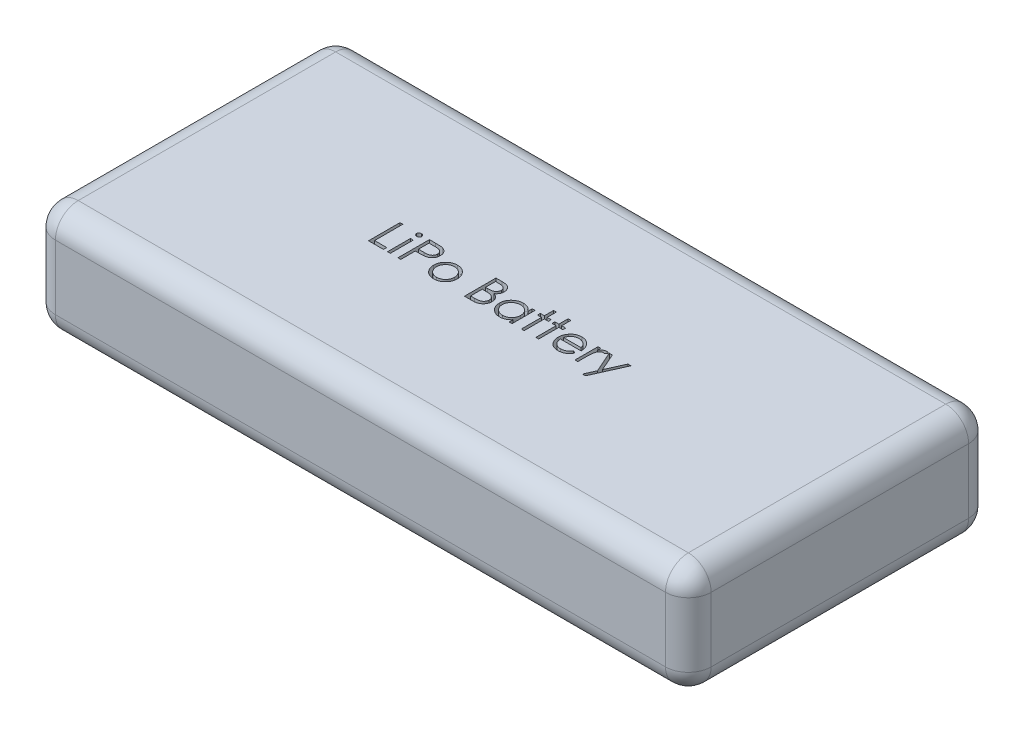
from build123d import *

# Parameters (mm, degrees)
SKETCH1_W           = 72.9742
SKETCH1_H           = 33.7312
BOSS_EXTRUDE1_DEPTH = 12.2682
SKETCH2_W           = 0.314102564
SKETCH2_H           = 2.557692308
CUT_EXTRUDE1_DEPTH  = 1.778
FILLET1_R           = 2.54


with BuildPart() as part:
    # Sketch1 → Boss-Extrude1 (new body)
    with BuildSketch(Plane(origin=(0, 0, 0), x_dir=(1, 0, 0), z_dir=(0, 1, 0))):
        with Locations((36.4871, 16.8656)):
            Rectangle(SKETCH1_W, SKETCH1_H)
    extrude(amount=BOSS_EXTRUDE1_DEPTH)

    # Sketch2 → Cut-Extrude1 (cut)
    # profile 1 of 12: a face of its own
    with BuildSketch(Plane(origin=(0, 12.2682, 0), x_dir=(1, 0, 0), z_dir=(0, 1, 0))):
        Polygon((22.570507121, 18.316928385), (22.884609685, 18.316928385), (22.884609685, 15.175902744), (24.230763531, 15.175902744), (24.230763531, 14.816928385), (22.570507121, 14.816928385), align=None)
    # profile 2 of 12: a face of its own
    with BuildSketch(Plane(origin=(0, 12.2682, 0), x_dir=(1, 0, 0), z_dir=(0, 1, 0))):
        with BuildLine():
            add(Edge.make_bspline(
                [(24.835130518, 18.45154377), (24.854621834, 18.450639617), (24.892789574, 18.448869113), (24.947982841, 18.433707636), (24.998239853, 18.408007951), (25.042817586, 18.37352827), (25.081069473, 18.332978826), (25.107850183, 18.285717858), (25.125062579, 18.234659219), (25.127141135, 18.19904413), (25.128199428, 18.180910757)],
                knots=[0, 0, 0, 0, 1.055194115, 2.066272739, 3.074728998, 4.095836921, 5.109056067, 6.073838105, 7.019297344, 8, 8, 8, 8], degree=3))
            add(Edge.make_bspline(
                [(25.128199428, 18.180910757), (25.127117268, 18.163248104), (25.124977967, 18.128331129), (25.107863478, 18.078157657), (25.08084124, 18.031553373), (25.042842115, 17.991082663), (24.998233354, 17.956622043), (24.947984568, 17.930917304), (24.892789119, 17.915757167), (24.85462168, 17.913986478), (24.835130518, 17.913082231)],
                knots=[0, 0, 0, 0, 0.96129708, 1.900370562, 2.859976407, 3.87933698, 4.906634145, 5.921202961, 6.938410037, 8, 8, 8, 8], degree=3))
            add(Edge.make_bspline(
                [(24.835130518, 17.913082231), (24.815862243, 17.913951951), (24.778359063, 17.915644748), (24.72399222, 17.931214766), (24.674163731, 17.956630839), (24.629499058, 17.990857024), (24.592268865, 18.031801921), (24.56517054, 18.078129215), (24.548095578, 18.12833837), (24.545950949, 18.163250536), (24.544866095, 18.180910757)],
                knots=[0, 0, 0, 0, 1.054934014, 2.053291228, 3.073705704, 4.106921865, 5.123545215, 6.088680038, 7.033164197, 8, 8, 8, 8], degree=3))
            add(Edge.make_bspline(
                [(24.544866095, 18.180910757), (24.545927182, 18.199041606), (24.548011223, 18.234651739), (24.565183339, 18.285746772), (24.592043147, 18.332728274), (24.62952371, 18.373753773), (24.67415717, 18.407999208), (24.723993915, 18.433410189), (24.778358615, 18.448981529), (24.815862091, 18.450674143), (24.835130518, 18.45154377)],
                knots=[0, 0, 0, 0, 0.98631895, 1.937192651, 2.907499808, 3.917963147, 4.944918757, 5.95915025, 6.951458133, 8, 8, 8, 8], degree=3))
        make_face()
    # profile 3 of 12: a face of its own
    with BuildSketch(Plane(origin=(0, 12.2682, 0), x_dir=(1, 0, 0), z_dir=(0, 1, 0))):
        with Locations((24.836532762, 16.095774539)):
            Rectangle(SKETCH2_W, SKETCH2_H)
    # profile 4 of 12: a face of its own
    with BuildSketch(Plane(origin=(0, 12.2682, 0), x_dir=(1, 0, 0), z_dir=(0, 1, 0))):
        with BuildLine():
            Line((25.846148146, 18.316928385), (26.532546383, 18.316928385))
            add(Edge.make_bspline(
                [(26.532546383, 18.316928385), (26.57975729, 18.316876489), (26.670215482, 18.316777053), (26.799930538, 18.313762307), (26.91774027, 18.309735615), (27.023390651, 18.304153722), (27.117206749, 18.297557132), (27.198764048, 18.288305093), (27.268703605, 18.278644797), (27.310610054, 18.26882339), (27.329721864, 18.26434425)],
                knots=[0, 0, 0, 0, 1.415646017, 2.712440637, 3.8905458, 4.950247383, 5.884950622, 6.709939814, 7.411656543, 8, 8, 8, 8], degree=3))
            add(Edge.make_bspline(
                [(27.329721864, 18.26434425), (27.353915398, 18.257722301), (27.401732375, 18.244634439), (27.470633418, 18.218420715), (27.536187264, 18.18733855), (27.598618822, 18.15191461), (27.657160905, 18.110629046), (27.712686946, 18.065155428), (27.764706927, 18.01444386), (27.812928318, 17.95906312), (27.857213116, 17.89994291), (27.895342799, 17.83620068), (27.927270026, 17.768909377), (27.954653297, 17.698115806), (27.974361752, 17.623225482), (27.989208651, 17.54475877), (27.998632279, 17.46272408), (27.999534841, 17.406664212), (27.9999943, 17.378126302)],
                knots=[0, 0, 0, 0, 0.999701418, 1.975846123, 2.934577507, 3.890451536, 4.834027766, 5.787354733, 6.749476667, 7.726910423, 8.712836071, 9.690891519, 10.682875813, 11.679750201, 12.712814741, 13.765529915, 14.8625177, 16, 16, 16, 16], degree=3))
            add(Edge.make_bspline(
                [(27.9999943, 17.378126302), (27.999572875, 17.349348525), (27.998748329, 17.293042861), (27.988852044, 17.210670073), (27.975521852, 17.131951683), (27.9550248, 17.057062232), (27.928179127, 16.986446462), (27.896687074, 16.91902523), (27.858703544, 16.855945558), (27.815058714, 16.79697844), (27.76650712, 16.742068528), (27.713254182, 16.691613733), (27.655514889, 16.645909395), (27.593472741, 16.604853051), (27.526522892, 16.569396772), (27.455680739, 16.537639467), (27.380330522, 16.510968406), (27.328188008, 16.496938345), (27.301676992, 16.489804988)],
                knots=[0, 0, 0, 0, 1.121902311, 2.195077645, 3.232258892, 4.234102512, 5.217864754, 6.176164875, 7.132989551, 8.084763148, 9.034132444, 9.988522005, 10.94243251, 11.903244335, 12.886203696, 13.894208494, 14.929344452, 16, 16, 16, 16], degree=3))
            add(Edge.make_bspline(
                [(27.301676992, 16.489804988), (27.279749658, 16.485142006), (27.231694631, 16.474922812), (27.152551909, 16.463514355), (27.060406523, 16.453776755), (26.955384243, 16.446475617), (26.837579338, 16.440225249), (26.706928081, 16.435257155), (26.563174004, 16.432527301), (26.462902759, 16.432386508), (26.410551191, 16.432313)],
                knots=[0, 0, 0, 0, 0.601384939, 1.31797006, 2.144135048, 3.087295005, 4.142315834, 5.309527816, 6.595305764, 8, 8, 8, 8], degree=3))
            Line((26.410551191, 16.432313), (26.16025071, 16.432313))
            Line((26.16025071, 16.432313), (26.16025071, 14.816928385))
            Line((26.16025071, 14.816928385), (25.846148146, 14.816928385))
            Line((25.846148146, 14.816928385), (25.846148146, 18.316928385))
        make_face()
        with BuildLine():
            Line((26.16025071, 17.957954026), (26.16025071, 16.791287359))
            Line((26.16025071, 16.791287359), (26.773031159, 16.78357502))
            add(Edge.make_bspline(
                [(26.773031159, 16.78357502), (26.802951085, 16.783559556), (26.860710885, 16.783529704), (26.944147108, 16.787514927), (27.021556395, 16.79211546), (27.092700971, 16.798851383), (27.157612905, 16.808372641), (27.216400434, 16.817984379), (27.268607717, 16.831889741), (27.329706919, 16.850612811), (27.397790266, 16.882545426), (27.471857815, 16.928895316), (27.534628401, 16.987976025), (27.588946698, 17.054403856), (27.632052576, 17.128302985), (27.663608568, 17.207371922), (27.682149725, 17.290799772), (27.684635919, 17.34788791), (27.685891736, 17.376724058)],
                knots=[0, 0, 0, 0, 1.160613943, 2.240541288, 3.23993089, 4.169200891, 5.011653406, 5.7853311, 6.478053781, 7.106038997, 8.262395093, 9.384106736, 10.481365981, 11.59014053, 12.70357646, 13.786202915, 14.881775077, 16, 16, 16, 16], degree=3))
            add(Edge.make_bspline(
                [(27.685891736, 17.376724058), (27.684629089, 17.404862572), (27.682119105, 17.460798454), (27.663463241, 17.542777214), (27.632113927, 17.621012919), (27.588657333, 17.693986004), (27.535916203, 17.760174808), (27.47461686, 17.817671935), (27.404903599, 17.863893638), (27.340055368, 17.893726919), (27.282454181, 17.911942195), (27.232422222, 17.924687035), (27.175931547, 17.934862642), (27.112963768, 17.943102144), (27.044006934, 17.950155606), (26.968468619, 17.954941583), (26.886634976, 17.957743039), (26.829824405, 17.957881994), (26.800374909, 17.957954026)],
                knots=[0, 0, 0, 0, 1.120700087, 2.227813068, 3.331159281, 4.466773991, 5.599788987, 6.693661531, 7.80175334, 8.91857717, 9.525282508, 10.207424825, 10.974604443, 11.810962634, 12.737642355, 13.736264703, 14.826523623, 16, 16, 16, 16], degree=3))
            Line((26.800374909, 17.957954026), (26.16025071, 17.957954026))
        make_face(mode=Mode.SUBTRACT)
    # profile 5 of 12: a face of its own
    with BuildSketch(Plane(origin=(0, 12.2682, 0), x_dir=(1, 0, 0), z_dir=(0, 1, 0))):
        with BuildLine():
            add(Edge.make_bspline(
                [(29.863576031, 17.419492488), (29.911567304, 17.418470596), (30.005666461, 17.416466918), (30.143474347, 17.395051952), (30.275019483, 17.362304588), (30.400805675, 17.317033026), (30.519221971, 17.256351075), (30.631993215, 17.183941784), (30.738810224, 17.09815919), (30.802833253, 17.031801122), (30.835330839, 16.998118289)],
                knots=[0, 0, 0, 0, 1.054011418, 2.066658804, 3.057071809, 4.030435133, 4.997543892, 5.974964718, 6.972108034, 8, 8, 8, 8], degree=3))
            add(Edge.make_bspline(
                [(30.835330839, 16.998118289), (30.863312793, 16.965904303), (30.918735173, 16.902099761), (30.989800892, 16.798644148), (31.051022452, 16.691504047), (31.100085413, 16.579256721), (31.138770436, 16.462882049), (31.166236133, 16.341980038), (31.182573068, 16.216817691), (31.184776035, 16.131813853), (31.185891736, 16.088763321)],
                knots=[0, 0, 0, 0, 1.025258237, 2.030674902, 3.01204498, 3.988269485, 4.97094183, 5.956517959, 6.965070386, 8, 8, 8, 8], degree=3))
            add(Edge.make_bspline(
                [(31.185891736, 16.088763321), (31.184910399, 16.045463263), (31.18297123, 15.95990033), (31.164627614, 15.833880964), (31.136096528, 15.711686141), (31.09526469, 15.593827448), (31.042906581, 15.47994462), (30.979015893, 15.370535071), (30.903144276, 15.265382938), (30.817140279, 15.165381099), (30.722088403, 15.073214885), (30.618972255, 14.992886615), (30.509818221, 14.924065091), (30.393174868, 14.868628675), (30.270107381, 14.824918975), (30.140350313, 14.794218958), (30.004105242, 14.775657275), (29.911078021, 14.773273701), (29.863576031, 14.77205659)],
                knots=[0, 0, 0, 0, 0.998656419, 1.973391657, 2.932242238, 3.890759089, 4.846373663, 5.82037756, 6.809684879, 7.83454468, 8.860553229, 9.859544525, 10.845671541, 11.83227036, 12.833544569, 13.85385346, 14.904124723, 16, 16, 16, 16], degree=3))
            add(Edge.make_bspline(
                [(29.863576031, 14.77205659), (29.815841311, 14.773277786), (29.722350452, 14.775669561), (29.58562447, 14.794146844), (29.455634851, 14.824904826), (29.332406252, 14.868772319), (29.215261405, 14.924066863), (29.105474908, 14.992678552), (29.002274993, 15.073238707), (28.907203008, 15.165374644), (28.821204403, 15.265384601), (28.745331395, 15.370534639), (28.681441069, 15.479944733), (28.629082865, 15.593827418), (28.588251052, 15.711686149), (28.559719959, 15.833880962), (28.541376345, 15.95990033), (28.539437176, 16.045463263), (28.538455839, 16.088763321)],
                knots=[0, 0, 0, 0, 1.099876186, 2.154163076, 3.173186993, 4.173200201, 5.163417411, 6.152872554, 7.150605724, 8.17532212, 9.198891216, 10.186952605, 11.159729845, 12.11414092, 13.071450619, 14.029093627, 15.002601286, 16, 16, 16, 16], degree=3))
            add(Edge.make_bspline(
                [(28.538455839, 16.088763321), (28.539579149, 16.131579867), (28.54180311, 16.216349269), (28.558123619, 16.34127633), (28.585482176, 16.461973719), (28.624213572, 16.577899195), (28.673728763, 16.689654631), (28.734090051, 16.797059462), (28.805880684, 16.900047262), (28.861082635, 16.963769342), (28.889016736, 16.996014923)],
                knots=[0, 0, 0, 0, 1.031353054, 2.041901799, 3.029428768, 4.008703097, 4.981709435, 5.96992636, 6.972712378, 8, 8, 8, 8], degree=3))
            add(Edge.make_bspline(
                [(28.889016736, 16.996014923), (28.921465327, 17.029989863), (28.985281191, 17.096807559), (29.092629919, 17.182340083), (29.20512374, 17.256256157), (29.324848666, 17.315732372), (29.450531524, 17.36257089), (29.582750766, 17.395136405), (29.721026282, 17.41638976), (29.815585903, 17.418447938), (29.863576031, 17.419492488)],
                knots=[0, 0, 0, 0, 1.027980169, 2.021703884, 2.998553061, 3.971491411, 4.943284454, 5.930300938, 6.949603206, 8, 8, 8, 8], degree=3))
        make_face()
        with BuildLine():
            add(Edge.make_bspline(
                [(29.862173787, 17.105389923), (29.828236176, 17.104425332), (29.761237047, 17.102521049), (29.662617463, 17.088037144), (29.567677309, 17.06508964), (29.476236464, 17.032485584), (29.388603292, 16.990386685), (29.30469389, 16.938678325), (29.22426145, 16.878045369), (29.148879386, 16.808582697), (29.079697074, 16.732703702), (29.019219098, 16.651855344), (28.967793991, 16.567348997), (28.924953832, 16.479096786), (28.893046644, 16.386204372), (28.869873622, 16.289723741), (28.855403381, 16.189458325), (28.853517003, 16.121297306), (28.852558403, 16.086659955)],
                knots=[0, 0, 0, 0, 1.021534396, 2.016698045, 2.994645724, 3.958388632, 4.93408049, 5.916473867, 6.921342795, 7.962252576, 8.998418191, 10.008913653, 10.997312074, 11.973003931, 12.956656626, 13.948281152, 14.957379055, 16, 16, 16, 16], degree=3))
            add(Edge.make_bspline(
                [(28.852558403, 16.086659955), (28.854165226, 16.041907928), (28.857354471, 15.953083523), (28.883289707, 15.8222724), (28.926675987, 15.696690548), (28.985263267, 15.577074162), (29.058669485, 15.466401884), (29.145156552, 15.3677304), (29.243796252, 15.282544588), (29.353412753, 15.211863743), (29.471767071, 15.155703987), (29.597023392, 15.115905011), (29.727664086, 15.090033319), (29.816944817, 15.087461844), (29.862173787, 15.086159154)],
                knots=[0, 0, 0, 0, 1.016792936, 2.018143844, 3.017858371, 4.030088057, 5.03801393, 6.028138512, 7.003788237, 7.991172063, 8.984598303, 9.972568034, 10.972917682, 12, 12, 12, 12], degree=3))
            add(Edge.make_bspline(
                [(29.862173787, 15.086159154), (29.907400156, 15.087469434), (29.996675752, 15.090055891), (30.127134929, 15.115774711), (30.252048901, 15.155878372), (30.370280288, 15.211800582), (30.479846892, 15.282812996), (30.579196013, 15.367249373), (30.664944624, 15.466663225), (30.738278229, 15.577220754), (30.797824972, 15.696505106), (30.841008174, 15.822295578), (30.86700576, 15.95307762), (30.870186588, 16.041905951), (30.871789172, 16.086659955)],
                knots=[0, 0, 0, 0, 1.02726834, 2.027799167, 3.010890988, 4.004497153, 4.992059811, 5.971914811, 6.958719428, 7.966827853, 8.981595046, 9.981490638, 10.983022906, 12, 12, 12, 12], degree=3))
            add(Edge.make_bspline(
                [(30.871789172, 16.086659955), (30.870830902, 16.121297513), (30.868945173, 16.189458939), (30.854470208, 16.289721392), (30.831314669, 16.386212989), (30.799343051, 16.479064992), (30.756689038, 16.567577497), (30.704272244, 16.651607224), (30.644041219, 16.73298377), (30.574024098, 16.808337411), (30.49872072, 16.878072447), (30.418255682, 16.938701837), (30.334470704, 16.990159432), (30.247092121, 17.032845673), (30.155639553, 17.064793013), (30.060832424, 17.088169644), (29.962633614, 17.102459841), (29.895874571, 17.104406983), (29.862173787, 17.105389923)],
                knots=[0, 0, 0, 0, 1.042956736, 2.052379634, 3.044323526, 4.02829302, 5.004299113, 5.996692471, 7.007513377, 8.048758398, 9.090003419, 10.095195979, 11.07790575, 12.047570684, 13.018257071, 13.989683339, 14.985167495, 16, 16, 16, 16], degree=3))
        make_face(mode=Mode.SUBTRACT)
    # profile 6 of 12: a face of its own
    with BuildSketch(Plane(origin=(0, 12.2682, 0), x_dir=(1, 0, 0), z_dir=(0, 1, 0))):
        with BuildLine():
            Line((33.2499943, 18.316928385), (33.932886928, 18.316928385))
            add(Edge.make_bspline(
                [(33.932886928, 18.316928385), (33.966315406, 18.316752635), (34.031108117, 18.316411987), (34.125327559, 18.311128855), (34.213576369, 18.303925186), (34.295880142, 18.292495093), (34.372200844, 18.278703316), (34.442768481, 18.2620015), (34.507358654, 18.241974886), (34.58447139, 18.210128605), (34.672392051, 18.162805436), (34.767590443, 18.092876871), (34.848994683, 18.007344408), (34.919181, 17.910861753), (34.97498212, 17.804725981), (35.015351417, 17.691466792), (35.040909292, 17.57254505), (35.043537727, 17.490901872), (35.044866095, 17.449640725)],
                knots=[0, 0, 0, 0, 1.001505555, 1.941167018, 2.826882275, 3.653841531, 4.429895133, 5.150066043, 5.825578002, 6.45369114, 7.647487171, 8.808567382, 9.977351308, 11.170798116, 12.373658725, 13.556498008, 14.765093433, 16, 16, 16, 16], degree=3))
            add(Edge.make_bspline(
                [(35.044866095, 17.449640725), (35.043772876, 17.410988169), (35.041624599, 17.335032252), (35.02108184, 17.223938143), (34.988921171, 17.118186924), (34.944215922, 17.018164538), (34.886113926, 16.926130925), (34.817255607, 16.841343659), (34.734178805, 16.767392602), (34.671935565, 16.7260497), (34.640318819, 16.705049379)],
                knots=[0, 0, 0, 0, 1.044552857, 2.05264487, 3.044412934, 4.028983338, 5.005914585, 5.980388656, 6.974128949, 8, 8, 8, 8], degree=3))
            add(Edge.make_bspline(
                [(34.640318819, 16.705049379), (34.680079247, 16.68978438), (34.756150794, 16.660578655), (34.860836807, 16.608943191), (34.951031652, 16.552781081), (35.027428798, 16.491449231), (35.092766453, 16.42534042), (35.149819394, 16.353485306), (35.198500768, 16.274946548), (35.240213692, 16.190543012), (35.272762448, 16.101136544), (35.297138352, 16.007565768), (35.311105801, 15.910166213), (35.313093443, 15.843880833), (35.314096864, 15.810417968)],
                knots=[0, 0, 0, 0, 1.27268992, 2.434971085, 3.483601985, 4.442670788, 5.356604649, 6.2567628, 7.179492994, 8.113709626, 9.066344395, 10.018646069, 10.999752585, 12, 12, 12, 12], degree=3))
            add(Edge.make_bspline(
                [(35.314096864, 15.810417968), (35.313120018, 15.776251096), (35.311198046, 15.709026818), (35.297018074, 15.610271684), (35.273008967, 15.515896737), (35.239937821, 15.425291554), (35.196775506, 15.33863142), (35.144247542, 15.255818156), (35.081615979, 15.177683825), (35.01155311, 15.103360202), (34.932290964, 15.036532415), (34.846775209, 14.977016708), (34.753928889, 14.928070646), (34.655276895, 14.886954624), (34.549712579, 14.855547426), (34.437709972, 14.833574852), (34.31936567, 14.818769815), (34.238155919, 14.81755261), (34.196508723, 14.816928385)],
                knots=[0, 0, 0, 0, 0.978564426, 1.925352924, 2.850884081, 3.763762016, 4.682927383, 5.618979971, 6.567305752, 7.547517671, 8.540179244, 9.531824382, 10.526200242, 11.540722885, 12.589160233, 13.674978461, 14.80764778, 16, 16, 16, 16], degree=3))
            Line((34.196508723, 14.816928385), (33.2499943, 14.816928385))
            Line((33.2499943, 14.816928385), (33.2499943, 18.316928385))
        make_face()
        with BuildLine():
            Line((33.564096864, 17.957954026), (33.564096864, 16.836159154))
            Line((33.564096864, 16.836159154), (33.775134524, 16.836159154))
            add(Edge.make_bspline(
                [(33.775134524, 16.836159154), (33.80598332, 16.836559077), (33.865589479, 16.83733181), (33.951909376, 16.839545327), (34.032034394, 16.84574337), (34.105826227, 16.851939632), (34.173168671, 16.86201422), (34.233912532, 16.874006343), (34.289011129, 16.886689248), (34.352550675, 16.908258735), (34.424623623, 16.94013641), (34.501456727, 16.989608246), (34.569191197, 17.0485326), (34.626388385, 17.116523561), (34.673199855, 17.191389747), (34.70571357, 17.271936628), (34.727760855, 17.35615676), (34.729752386, 17.413975012), (34.730763531, 17.443330629)],
                knots=[0, 0, 0, 0, 1.156816544, 2.235205308, 3.236616184, 4.169592532, 5.011045266, 5.787822928, 6.49130361, 7.128639758, 8.301311294, 9.436451833, 10.541879658, 11.654887649, 12.756523258, 13.837046038, 14.901820046, 16, 16, 16, 16], degree=3))
            add(Edge.make_bspline(
                [(34.730763531, 17.443330629), (34.730237351, 17.4627564), (34.729205191, 17.500862172), (34.720751888, 17.556411526), (34.706384314, 17.608655279), (34.68793002, 17.658309389), (34.662141332, 17.703821239), (34.631777868, 17.746764435), (34.595092178, 17.785676554), (34.553334866, 17.822046052), (34.505326243, 17.85429058), (34.451094951, 17.882531343), (34.389907274, 17.90527212), (34.322794419, 17.925188272), (34.248723331, 17.939176566), (34.168548778, 17.950829954), (34.081614059, 17.956762696), (34.021468956, 17.957548058), (33.990378915, 17.957954026)],
                knots=[0, 0, 0, 0, 0.91205012, 1.789085906, 2.630437955, 3.453916878, 4.269457761, 5.079663411, 5.91843418, 6.774407191, 7.675494373, 8.627863946, 9.638891023, 10.736472738, 11.911756761, 13.175263542, 14.539845004, 16, 16, 16, 16], degree=3))
            Line((33.990378915, 17.957954026), (33.564096864, 17.957954026))
        make_face(mode=Mode.SUBTRACT)
        with BuildLine():
            Line((33.564096864, 16.477184795), (33.564096864, 15.175902744))
            Line((33.564096864, 15.175902744), (34.011412569, 15.175902744))
            add(Edge.make_bspline(
                [(34.011412569, 15.175902744), (34.043431495, 15.176286491), (34.105143754, 15.177026114), (34.194244984, 15.179440668), (34.276828088, 15.184932944), (34.352516223, 15.193578794), (34.422126676, 15.202957243), (34.484824379, 15.215568524), (34.541117573, 15.230017484), (34.60639188, 15.252351657), (34.679895389, 15.287048128), (34.759106245, 15.339362354), (34.829532463, 15.401685662), (34.889337722, 15.473816576), (34.938350711, 15.552247903), (34.974006166, 15.635393253), (34.995997023, 15.72187878), (34.998659192, 15.780845493), (34.9999943, 15.810417968)],
                knots=[0, 0, 0, 0, 1.160039823, 2.235823828, 3.228722157, 4.157150951, 4.99529583, 5.772374946, 6.472645482, 7.099169577, 8.269452708, 9.405989375, 10.527446681, 11.663510218, 12.788923519, 13.866172445, 14.929861265, 16, 16, 16, 16], degree=3))
            add(Edge.make_bspline(
                [(34.9999943, 15.810417968), (34.999718196, 15.828911309), (34.999170441, 15.865599691), (34.990909826, 15.91951551), (34.978895956, 15.971741383), (34.963364522, 16.022419124), (34.940745055, 16.0706325), (34.91433851, 16.117335059), (34.883377108, 16.162588539), (34.835132942, 16.219800792), (34.764960958, 16.285717805), (34.665254182, 16.350255308), (34.551881884, 16.402303115), (34.469654392, 16.424402591), (34.427177794, 16.435818609)],
                knots=[0, 0, 0, 0, 0.723448775, 1.435228256, 2.130040452, 2.821711965, 3.505591119, 4.210454504, 4.921174351, 5.648778258, 7.137944449, 8.670945889, 10.280296675, 12, 12, 12, 12], degree=3))
            add(Edge.make_bspline(
                [(34.427177794, 16.435818609), (34.410148698, 16.439273693), (34.373226105, 16.446765028), (34.313018525, 16.454672731), (34.244282656, 16.461717791), (34.166859779, 16.466928949), (34.080651938, 16.472315492), (33.985475019, 16.474410314), (33.881717704, 16.476909574), (33.809725332, 16.477090708), (33.772330037, 16.477184795)],
                knots=[0, 0, 0, 0, 0.634451884, 1.375622551, 2.216452059, 3.157844607, 4.20941857, 5.370758133, 6.634282058, 8, 8, 8, 8], degree=3))
            Line((33.772330037, 16.477184795), (33.564096864, 16.477184795))
        make_face(mode=Mode.SUBTRACT)
    # profile 7 of 12: a face of its own
    with BuildSketch(Plane(origin=(0, 12.2682, 0), x_dir=(1, 0, 0), z_dir=(0, 1, 0))):
        with BuildLine():
            Line((38.544866095, 17.374620693), (38.544866095, 14.816928385))
            Line((38.544866095, 14.816928385), (38.230763531, 14.816928385))
            Line((38.230763531, 14.816928385), (38.230763531, 15.259336238))
            add(Edge.make_bspline(
                [(38.230763531, 15.259336238), (38.19534474, 15.219296644), (38.126224525, 15.141158873), (38.010783407, 15.0390767), (37.888415229, 14.954698378), (37.759713908, 14.886548463), (37.624795665, 14.835356406), (37.483959577, 14.798970247), (37.337148196, 14.775576412), (37.236895842, 14.77324039), (37.186092056, 14.77205659)],
                knots=[0, 0, 0, 0, 1.074387032, 2.096679803, 3.090159297, 4.057316773, 5.018401886, 5.985159533, 6.978961417, 8, 8, 8, 8], degree=3))
            add(Edge.make_bspline(
                [(37.186092056, 14.77205659), (37.140924103, 14.773282962), (37.051850898, 14.775701423), (36.920821821, 14.794463726), (36.794729571, 14.824594348), (36.673454998, 14.866495238), (36.557782853, 14.922076059), (36.446722756, 14.988617307), (36.340850064, 15.067858137), (36.241778525, 15.158446166), (36.150546525, 15.256841153), (36.070485252, 15.3617867), (36.003732173, 15.472829004), (35.947912092, 15.588562157), (35.904915747, 15.709877077), (35.874942113, 15.836354245), (35.856201666, 15.967844119), (35.853784206, 16.057383642), (35.852558403, 16.102785757)],
                knots=[0, 0, 0, 0, 1.033919861, 2.038935746, 3.024066025, 3.998881131, 4.97069526, 5.957263378, 6.95902576, 7.993208707, 9.027059324, 10.027763471, 11.009749337, 11.988697705, 12.965288445, 13.950418724, 14.960734635, 16, 16, 16, 16], degree=3))
            add(Edge.make_bspline(
                [(35.852558403, 16.102785757), (35.853811374, 16.14724946), (35.856288431, 16.235151804), (35.874741651, 16.364430502), (35.905772659, 16.488948762), (35.949320507, 16.608305706), (36.005162462, 16.722645756), (36.073090549, 16.832049781), (36.153109674, 16.936819178), (36.245362081, 17.034490405), (36.345296851, 17.124711019), (36.452205582, 17.203120065), (36.563428863, 17.270836914), (36.680691874, 17.32449039), (36.802258978, 17.367899494), (36.929212424, 17.397932463), (37.061024003, 17.415629784), (37.150514495, 17.418192548), (37.195907762, 17.419492488)],
                knots=[0, 0, 0, 0, 1.020392517, 2.01726096, 2.990465484, 3.961182959, 4.928053699, 5.906110375, 6.912531644, 7.948652711, 8.985773172, 9.998621852, 10.987621588, 11.969261332, 12.953316658, 13.946091881, 14.958173133, 16, 16, 16, 16], degree=3))
            add(Edge.make_bspline(
                [(37.195907762, 17.419492488), (37.248107621, 17.418054736), (37.350469081, 17.415235373), (37.50019709, 17.391772646), (37.641841568, 17.352134179), (37.77649592, 17.298216681), (37.903676606, 17.226567952), (38.02217959, 17.13618799), (38.133245074, 17.027646804), (38.197625365, 16.944276359), (38.230763531, 16.901363481)],
                knots=[0, 0, 0, 0, 1.038897134, 2.037228247, 3.008116434, 3.962042015, 4.918381754, 5.904844433, 6.921570401, 8, 8, 8, 8], degree=3))
            Line((38.230763531, 16.901363481), (38.230763531, 17.374620693))
            Line((38.230763531, 17.374620693), (38.544866095, 17.374620693))
        make_face()
        with BuildLine():
            add(Edge.make_bspline(
                [(37.200114492, 17.105389923), (37.154200154, 17.103756286), (37.063572555, 17.100531745), (36.930528552, 17.075358249), (36.803215138, 17.033473655), (36.682269064, 16.976191754), (36.569600847, 16.904163017), (36.468907177, 16.817041634), (36.379364475, 16.71720462), (36.304056211, 16.60510251), (36.242665714, 16.484924418), (36.199498682, 16.35929998), (36.171029435, 16.230495003), (36.168120914, 16.143132317), (36.166660967, 16.099280148)],
                knots=[0, 0, 0, 0, 1.031046209, 2.035121221, 3.029706178, 4.034933723, 5.034054252, 6.02443088, 7.017295772, 8.038157696, 9.050218397, 10.03989886, 11.016116709, 12, 12, 12, 12], degree=3))
            add(Edge.make_bspline(
                [(36.166660967, 16.099280148), (36.16852586, 16.055690041), (36.172248337, 15.968680685), (36.198999031, 15.839700108), (36.243878905, 15.714046066), (36.305120967, 15.592785072), (36.381807592, 15.480200972), (36.470696245, 15.378460849), (36.572646526, 15.290971261), (36.685574033, 15.217733688), (36.806182004, 15.158571167), (36.933015935, 15.117405527), (37.063691573, 15.090827747), (37.152543907, 15.08772327), (37.197310005, 15.086159154)],
                knots=[0, 0, 0, 0, 0.979072187, 1.954306742, 2.945804271, 3.96968567, 4.997920485, 5.998718438, 6.996577872, 8.005894225, 9.015743152, 10.005417472, 10.995077863, 12, 12, 12, 12], degree=3))
            add(Edge.make_bspline(
                [(37.197310005, 15.086159154), (37.242756508, 15.087819118), (37.333145094, 15.091120622), (37.466583802, 15.116401887), (37.596078765, 15.158170685), (37.719865994, 15.216069812), (37.835182125, 15.287827168), (37.938680002, 15.371834259), (38.026195971, 15.469537443), (38.10038858, 15.576913896), (38.158563997, 15.694625893), (38.200940056, 15.819960083), (38.225993962, 15.952920832), (38.229151692, 16.043784759), (38.230763531, 16.090165564)],
                knots=[0, 0, 0, 0, 1.01762866, 2.023962475, 3.030623092, 4.058876274, 5.077231937, 6.066672613, 7.034107872, 8.005628644, 8.981990164, 9.965428785, 10.961468474, 12, 12, 12, 12], degree=3))
            add(Edge.make_bspline(
                [(38.230763531, 16.090165564), (38.229803874, 16.125503395), (38.227914967, 16.195059428), (38.213484397, 16.297186946), (38.190529471, 16.394920672), (38.158183301, 16.488363361), (38.115692017, 16.576998376), (38.064444251, 16.661462137), (38.003538801, 16.741315348), (37.933956105, 16.815458419), (37.857790902, 16.883084881), (37.777196362, 16.943449122), (37.691217615, 16.993037895), (37.601300578, 17.034079166), (37.507289243, 17.066738316), (37.408418624, 17.08852601), (37.305739637, 17.103486331), (37.235693581, 17.104748712), (37.200114492, 17.105389923)],
                knots=[0, 0, 0, 0, 1.050140795, 2.067009409, 3.05949893, 4.030605086, 5.00011959, 5.97591094, 6.962425594, 7.979863591, 8.993523472, 9.986985069, 10.967611495, 11.937549037, 12.921786183, 13.919465291, 14.943216303, 16, 16, 16, 16], degree=3))
        make_face(mode=Mode.SUBTRACT)
    # profile 8 of 12: a face of its own
    with BuildSketch(Plane(origin=(0, 12.2682, 0), x_dir=(1, 0, 0), z_dir=(0, 1, 0))):
        Polygon((39.576917377, 18.406671975), (39.891019941, 18.406671975), (39.891019941, 17.374620693), (40.33973789, 17.374620693), (40.33973789, 17.060518129), (39.891019941, 17.060518129), (39.891019941, 14.816928385), (39.576917377, 14.816928385), (39.576917377, 17.060518129), (39.128199428, 17.060518129), (39.128199428, 17.374620693), (39.576917377, 17.374620693), align=None)
    # profile 9 of 12: a face of its own
    with BuildSketch(Plane(origin=(0, 12.2682, 0), x_dir=(1, 0, 0), z_dir=(0, 1, 0))):
        Polygon((41.192301992, 18.406671975), (41.506404556, 18.406671975), (41.506404556, 17.374620693), (41.955122505, 17.374620693), (41.955122505, 17.060518129), (41.506404556, 17.060518129), (41.506404556, 14.816928385), (41.192301992, 14.816928385), (41.192301992, 17.060518129), (40.743584044, 17.060518129), (40.743584044, 17.374620693), (41.192301992, 17.374620693), align=None)
    # profile 10 of 12: a face of its own
    with BuildSketch(Plane(origin=(0, 12.2682, 0), x_dir=(1, 0, 0), z_dir=(0, 1, 0))):
        with BuildLine():
            Line((44.592742697, 15.624620693), (44.871789172, 15.478086238))
            add(Edge.make_bspline(
                [(44.871789172, 15.478086238), (44.849552577, 15.438642906), (44.806288968, 15.361901803), (44.73188822, 15.256469943), (44.653896148, 15.161622227), (44.56879218, 15.079892573), (44.479122501, 15.008641188), (44.384389846, 14.946303363), (44.284101028, 14.893184843), (44.178251303, 14.848432315), (44.065951752, 14.814022821), (43.946930236, 14.7897186), (43.82095874, 14.774695331), (43.734612561, 14.77295019), (43.690398947, 14.77205659)],
                knots=[0, 0, 0, 0, 1.120438281, 2.179929193, 3.190490725, 4.156257408, 5.095198341, 6.022838206, 6.959905092, 7.901321166, 8.864066838, 9.862729781, 10.905609505, 12, 12, 12, 12], degree=3))
            add(Edge.make_bspline(
                [(43.690398947, 14.77205659), (43.64125697, 14.773203765), (43.545395208, 14.775441572), (43.405855461, 14.794734037), (43.274476043, 14.826206395), (43.151264339, 14.870171937), (43.036522087, 14.927599261), (42.930021232, 14.997558743), (42.831201706, 15.079690997), (42.743177497, 15.174707441), (42.663933614, 15.276389398), (42.594007794, 15.382345283), (42.535550363, 15.492308507), (42.487997753, 15.605579031), (42.449592888, 15.721442925), (42.422826184, 15.840954392), (42.407396436, 15.963789977), (42.405031991, 16.046887312), (42.403840454, 16.088763321)],
                knots=[0, 0, 0, 0, 1.145258523, 2.234067595, 3.276747158, 4.290159414, 5.277019952, 6.260822364, 7.254936242, 8.264827045, 9.274100331, 10.257902744, 11.220704747, 12.172965371, 13.118907548, 14.062713208, 15.023725156, 16, 16, 16, 16], degree=3))
            add(Edge.make_bspline(
                [(42.403840454, 16.088763321), (42.404899595, 16.128058151), (42.406998673, 16.205935316), (42.420229461, 16.321200861), (42.443677754, 16.433229313), (42.475854078, 16.542113761), (42.517405324, 16.647671895), (42.568237543, 16.749967959), (42.628429921, 16.848893098), (42.674902595, 16.911296232), (42.698311608, 16.942729667)],
                knots=[0, 0, 0, 0, 1.024358464, 2.0301432, 3.019427413, 4.004406732, 4.986367066, 5.972626655, 6.978780325, 8, 8, 8, 8], degree=3))
            add(Edge.make_bspline(
                [(42.698311608, 16.942729667), (42.730019291, 16.980598537), (42.792430237, 17.055136688), (42.897986592, 17.153075013), (43.012286789, 17.235118789), (43.133898415, 17.303125925), (43.264234889, 17.354799572), (43.40154418, 17.393307154), (43.547389766, 17.414885165), (43.647094987, 17.417932999), (43.698111287, 17.419492488)],
                knots=[0, 0, 0, 0, 1.030682036, 2.02871468, 2.997146059, 3.962720338, 4.930598197, 5.918074684, 6.934738563, 8, 8, 8, 8], degree=3))
            add(Edge.make_bspline(
                [(43.698111287, 17.419492488), (43.750558893, 17.418138439), (43.853449138, 17.415482103), (44.00348126, 17.39085577), (44.145441976, 17.351803215), (44.27927448, 17.296649425), (44.404992341, 17.225489873), (44.521778391, 17.137348032), (44.631629903, 17.034929944), (44.695538482, 16.956166735), (44.728059204, 16.916087039)],
                knots=[0, 0, 0, 0, 1.056321875, 2.072262726, 3.055038591, 4.01806755, 4.982017516, 5.957941055, 6.960871419, 8, 8, 8, 8], degree=3))
            add(Edge.make_bspline(
                [(44.728059204, 16.916087039), (44.750186142, 16.885883457), (44.794292735, 16.825677339), (44.849539835, 16.727506182), (44.89749723, 16.624795587), (44.935830191, 16.51588529), (44.966869693, 16.40206571), (44.989326511, 16.282523165), (45.00249613, 16.157293254), (45.005084827, 16.071966698), (45.006404556, 16.028466847)],
                knots=[0, 0, 0, 0, 0.94817472, 1.890038105, 2.849395472, 3.817997239, 4.812318967, 5.836947057, 6.897266129, 8, 8, 8, 8], degree=3))
            Line((45.006404556, 16.028466847), (42.717943018, 16.028466847))
            add(Edge.make_bspline(
                [(42.717943018, 16.028466847), (42.719482624, 15.994766382), (42.722510198, 15.928495779), (42.736625342, 15.831524995), (42.758874115, 15.739151653), (42.790143178, 15.652068611), (42.828010023, 15.569138484), (42.87439574, 15.490976447), (42.929735294, 15.417938517), (42.991460993, 15.349371379), (43.060168089, 15.288310618), (43.132450836, 15.233658842), (43.209344401, 15.187853245), (43.290242484, 15.150673355), (43.37501427, 15.121567039), (43.463686465, 15.101699219), (43.556084581, 15.088392112), (43.619070315, 15.086912446), (43.651136127, 15.086159154)],
                knots=[0, 0, 0, 0, 1.094153842, 2.151609401, 3.174256925, 4.172055639, 5.149267565, 6.128595816, 7.11444997, 8.118368179, 9.117203808, 10.09244225, 11.054858984, 12.015122123, 12.976791628, 13.957293641, 14.960065497, 16, 16, 16, 16], degree=3))
            add(Edge.make_bspline(
                [(43.651136127, 15.086159154), (43.682487275, 15.086767211), (43.744693966, 15.087973712), (43.837334823, 15.099705623), (43.92847435, 15.118675898), (44.017735334, 15.144565889), (44.103306179, 15.176142741), (44.18255173, 15.214245598), (44.255431945, 15.256395345), (44.323548912, 15.30460502), (44.389619905, 15.363613207), (44.455162391, 15.437248928), (44.525439045, 15.524336456), (44.569428638, 15.589882122), (44.592742697, 15.624620693)],
                knots=[0, 0, 0, 0, 0.99110716, 1.966546729, 2.947904876, 3.932708344, 4.903319531, 5.828989031, 6.710028674, 7.56322171, 8.463672341, 9.504779593, 10.677557249, 12, 12, 12, 12], degree=3))
        make_face()
        with BuildLine():
            add(Edge.make_bspline(
                [(44.692301992, 16.342569411), (44.680805368, 16.384232284), (44.658678066, 16.464419905), (44.612441702, 16.575460795), (44.560370161, 16.674148696), (44.49874843, 16.759728329), (44.428929704, 16.835731842), (44.348284522, 16.902150428), (44.257848628, 16.961567879), (44.158089487, 17.011720378), (44.052447702, 17.054410237), (43.94184151, 17.083035353), (43.828983722, 17.102644895), (43.752649436, 17.104471003), (43.714237089, 17.105389923)],
                knots=[0, 0, 0, 0, 1.154881502, 2.222775134, 3.210006277, 4.132804581, 5.035138423, 5.962687519, 6.919655026, 7.923214229, 8.944639381, 9.960483929, 10.97369054, 12, 12, 12, 12], degree=3))
            add(Edge.make_bspline(
                [(43.714237089, 17.105389923), (43.68288765, 17.104778252), (43.620916401, 17.103569106), (43.529615333, 17.092098977), (43.441935634, 17.073139132), (43.357230346, 17.047174175), (43.276609478, 17.012565573), (43.19841471, 16.971982346), (43.124634313, 16.922440762), (43.078493018, 16.884681907), (43.055182601, 16.86560627)],
                knots=[0, 0, 0, 0, 1.04873581, 2.073130211, 3.073294108, 4.04793562, 5.032784715, 6.005352987, 6.992311501, 8, 8, 8, 8], degree=3))
            add(Edge.make_bspline(
                [(43.055182601, 16.86560627), (43.038489319, 16.850511954), (43.004706185, 16.819964738), (42.959565664, 16.767335531), (42.916345191, 16.710583969), (42.877011538, 16.647538845), (42.840933952, 16.578918066), (42.807173975, 16.50530043), (42.776787563, 16.4261273), (42.759691452, 16.370954861), (42.750895742, 16.342569411)],
                knots=[0, 0, 0, 0, 0.879870761, 1.780643979, 2.707998968, 3.669668524, 4.684282772, 5.740141944, 6.837334558, 8, 8, 8, 8], degree=3))
            Line((42.750895742, 16.342569411), (44.692301992, 16.342569411))
        make_face(mode=Mode.SUBTRACT)
    # profile 11 of 12: a face of its own
    with BuildSketch(Plane(origin=(0, 12.2682, 0), x_dir=(1, 0, 0), z_dir=(0, 1, 0))):
        with BuildLine():
            Line((45.544866095, 17.374620693), (45.858968659, 17.374620693))
            Line((45.858968659, 17.374620693), (45.858968659, 16.998118289))
            add(Edge.make_bspline(
                [(45.858968659, 16.998118289), (45.882157418, 17.033174117), (45.926505739, 17.100218116), (46.000218668, 17.188887417), (46.075721999, 17.262302464), (46.153377187, 17.320805983), (46.233755287, 17.364619102), (46.315092238, 17.396712137), (46.398667708, 17.415689452), (46.454829632, 17.418223111), (46.482967056, 17.419492488)],
                knots=[0, 0, 0, 0, 1.2804753, 2.448899062, 3.506932113, 4.484331642, 5.4025378, 6.288909075, 7.142734305, 8, 8, 8, 8], degree=3))
            add(Edge.make_bspline(
                [(46.482967056, 17.419492488), (46.504793383, 17.418301961), (46.549702468, 17.415852375), (46.617685058, 17.39864155), (46.68772851, 17.371163528), (46.732870897, 17.345323305), (46.756404556, 17.331852263)],
                knots=[0, 0, 0, 0, 0.901110191, 1.854092781, 2.881294221, 4, 4, 4, 4], degree=3))
            Line((46.756404556, 17.331852263), (46.583928595, 17.059817007))
            add(Edge.make_bspline(
                [(46.583928595, 17.059817007), (46.568819574, 17.066557273), (46.540139759, 17.079351588), (46.498185193, 17.094493598), (46.459503856, 17.103409514), (46.434860298, 17.104760232), (46.423371704, 17.105389923)],
                knots=[0, 0, 0, 0, 1.180555205, 2.24091978, 3.179933427, 4, 4, 4, 4], degree=3))
            add(Edge.make_bspline(
                [(46.423371704, 17.105389923), (46.39816597, 17.103709886), (46.34675358, 17.100283097), (46.271269081, 17.073344289), (46.198021876, 17.029819049), (46.139850213, 16.981547937), (46.09480796, 16.93500014), (46.062667735, 16.894351737), (46.033184988, 16.848773106), (46.005014767, 16.799043422), (45.979348473, 16.744313576), (45.955393804, 16.685130362), (45.933734941, 16.621425234), (45.921384697, 16.577042713), (45.915058403, 16.554308193)],
                knots=[0, 0, 0, 0, 1.125678352, 2.296057538, 3.5422874, 4.923748041, 5.663163013, 6.437101912, 7.23742474, 8.08941207, 8.991984279, 9.93940061, 10.944477711, 12, 12, 12, 12], degree=3))
            add(Edge.make_bspline(
                [(45.915058403, 16.554308193), (45.910326009, 16.534031019), (45.899844118, 16.48911862), (45.88965258, 16.413770096), (45.879583062, 16.324746437), (45.872486443, 16.221799844), (45.865908401, 16.1051874), (45.862198319, 15.974731455), (45.859095178, 15.830298103), (45.859012112, 15.72932375), (45.858968659, 15.676503705)],
                knots=[0, 0, 0, 0, 0.566838948, 1.255505196, 2.06880316, 3.007127437, 4.065329342, 5.249902469, 6.561414163, 8, 8, 8, 8], degree=3))
            Line((45.858968659, 15.676503705), (45.858968659, 14.816928385))
            Line((45.858968659, 14.816928385), (45.544866095, 14.816928385))
            Line((45.544866095, 14.816928385), (45.544866095, 17.374620693))
        make_face()
    # profile 12 of 12: a face of its own
    with BuildSketch(Plane(origin=(0, 12.2682, 0), x_dir=(1, 0, 0), z_dir=(0, 1, 0))):
        Polygon((46.801276351, 17.374620693), (47.139918178, 17.374620693), (48.005803595, 15.415686398), (48.885010326, 17.374620693), (49.224353274, 17.374620693), (47.653840454, 13.874620693), (47.314497505, 13.874620693), (47.835430999, 15.034977263), align=None)
    extrude(amount=-CUT_EXTRUDE1_DEPTH, mode=Mode.SUBTRACT)

    # Fillet1
    fillet1_edges = [part.edges().sort_by_distance(p)[0] for p in [
        (0, 12.2682, -16.8656),
        (0, 0, -16.8656),
        (0, 6.1341, 0),
        (36.4871, 12.2682, 0),
        (36.4871, 0, 0),
        (72.9742, 6.1341, 0),
        (72.9742, 12.2682, -16.8656),
        (72.9742, 0, -16.8656),
        (72.9742, 6.1341, -33.7312),
        (36.4871, 12.2682, -33.7312),
        (0, 6.1341, -33.7312),
        (36.4871, 0, -33.7312),
    ]]
    fillet(fillet1_edges, radius=FILLET1_R)


solid = part.part
